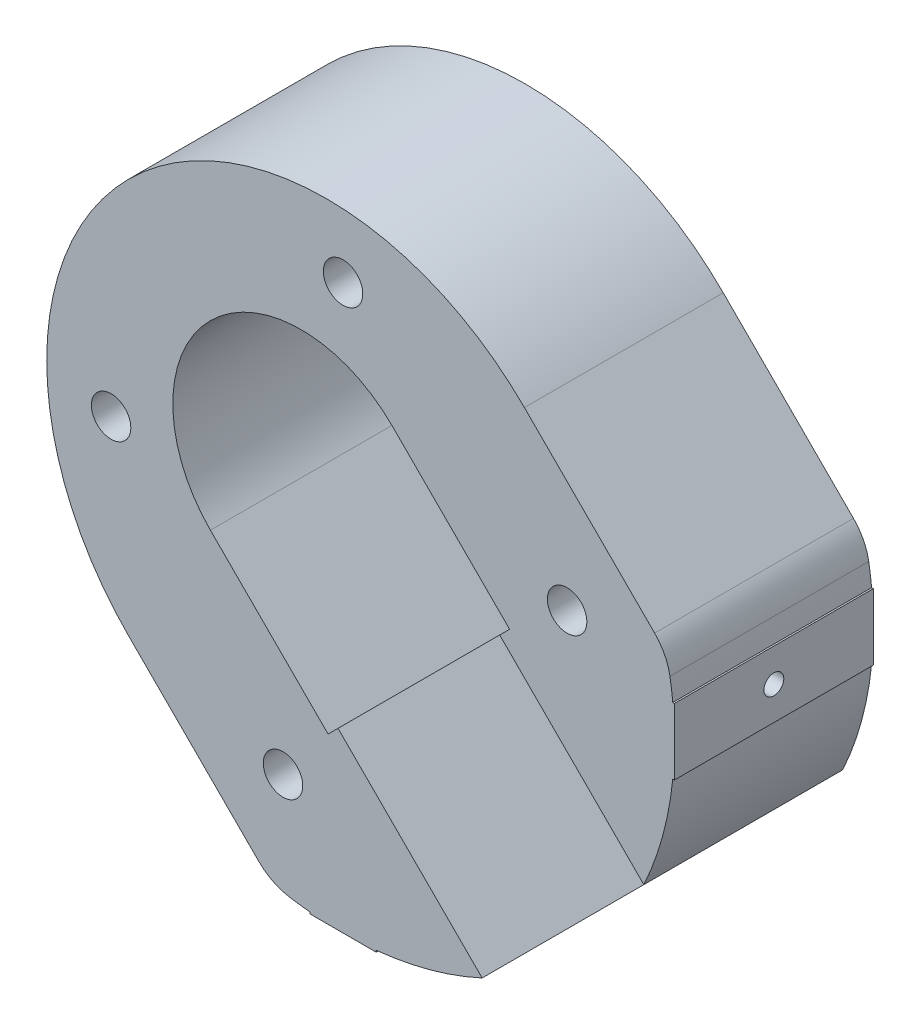
from build123d import *

# Parameters (mm, degrees)
BOSS_EXTRUDE1_DEPTH      = 15
BOSS_EXTRUDE1_DEPTH_BACK = 15
SKETCH2_R                = 1.5
CUT_EXTRUDE1_DEPTH       = 24
SKETCH3_R                = 1.5
CUT_EXTRUDE2_DEPTH       = 24
SKETCH6_R                = 2.9765625
CUT_EXTRUDE4_DEPTH       = 73.284161474


with BuildPart() as part:
    # Sketch1 → Boss-Extrude1 (new, two sides: drawn at the far end of the back side and taken through both)
    with BuildSketch(Plane.XY.offset(-BOSS_EXTRUDE1_DEPTH_BACK)):
        with BuildLine():
            Line((5, -50), (-5, -50))
            Line((-5, -50), (-5, -49.749371855))
            ThreePointArc((-5, -49.749371855), (-6.608385874, -49.561368384), (-8.209840211, -49.321379986))
            ThreePointArc((-8.209840211, -49.321379986), (-10.634728593, -48.517643399), (-12.698502349, -47.012015938))
            Line((-12.698502349, -47.012015938), (-32.34439039, -27.366127897))
            ThreePointArc((-32.34439039, -27.366127897), (-32.34439039, 32.34439039), (27.366127897, 32.34439039))
            Line((27.366127897, 32.34439039), (47.012015938, 12.698502349))
            ThreePointArc((47.012015938, 12.698502349), (48.517643399, 10.634728593), (49.321379986, 8.209840211))
            ThreePointArc((49.321379986, 8.209840211), (49.561368384, 6.608385874), (49.749371855, 5))
            Line((49.749371855, 5), (50, 5))
            Line((50, 5), (50, -5))
            Line((50, -5), (49.749371855, -5))
            ThreePointArc((49.749371855, -5), (48.232775306, -13.175711984), (45.38220814, -20.987024189))
            Line((45.38220814, -20.987024189), (23.63175062, 0.763433331))
            Line((23.63175062, 0.763433331), (25.128673235, 2.260355947))
            Line((25.128673235, 2.260355947), (7.371511647, 20.017517534))
            ThreePointArc((7.371511647, 20.017517534), (-20.017517534, 20.017517534), (-20.017517534, -7.371511647))
            Line((-20.017517534, -7.371511647), (-2.260355947, -25.128673235))
            Line((-2.260355947, -25.128673235), (-0.763433331, -23.63175062))
            Line((-0.763433331, -23.63175062), (20.987024189, -45.38220814))
            ThreePointArc((20.987024189, -45.38220814), (13.175711984, -48.232775306), (5, -49.749371855))
            Line((5, -49.749371855), (5, -50))
        make_face()
    extrude(amount=BOSS_EXTRUDE1_DEPTH + BOSS_EXTRUDE1_DEPTH_BACK)

    # Sketch2 → Cut-Extrude1 (cut)
    with BuildSketch(Plane(origin=(0, -50, 0), x_dir=(1, 0, 0), z_dir=(0, 1, 0))):
        Circle(SKETCH2_R)
    extrude(amount=CUT_EXTRUDE1_DEPTH, mode=Mode.SUBTRACT)

    # Sketch3 → Cut-Extrude2 (cut)
    with BuildSketch(Plane(origin=(50, 0, 0), x_dir=(0, 0, -1), z_dir=(1, 0, 0))):
        Circle(SKETCH3_R)
    extrude(amount=-CUT_EXTRUDE2_DEPTH, mode=Mode.SUBTRACT)

    # Sketch6 → Cut-Extrude4 (cut, through all)
    with BuildSketch(Plane.XY):
        with Locations((-9.058666579, -33.80740392)):
            Circle(SKETCH6_R)
        with Locations((-35, 0)):
            Circle(SKETCH6_R)
        with Locations((0, 35)):
            Circle(SKETCH6_R)
        with Locations((33.80740392, 9.058666579)):
            Circle(SKETCH6_R)
    extrude(amount=CUT_EXTRUDE4_DEPTH, mode=Mode.SUBTRACT)


solid = part.part
